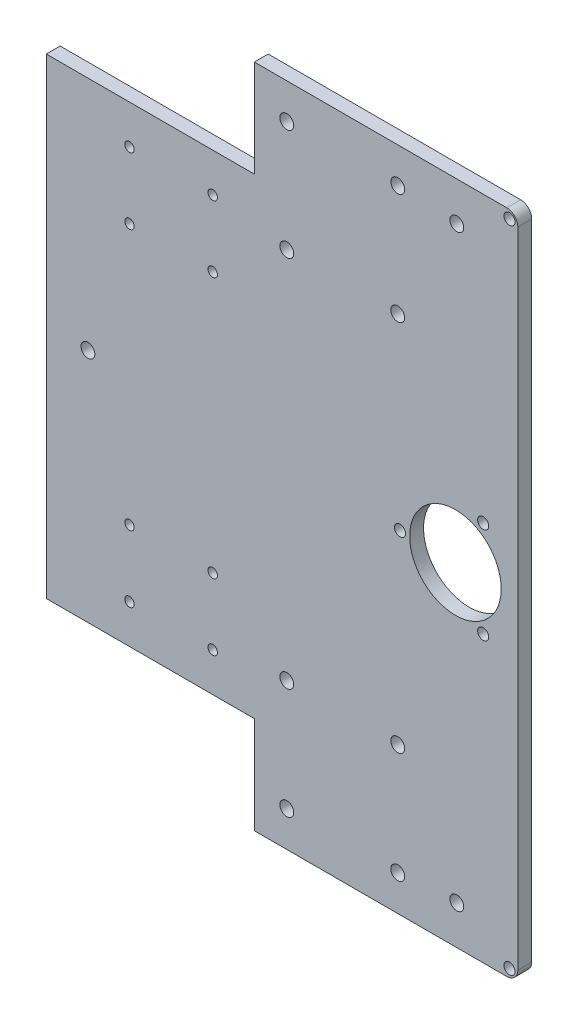
from build123d import *

# Parameters (mm, degrees)
SKETCH1_W           = 170
SKETCH1_H           = 240
BOSS_EXTRUDE1_DEPTH = 5
SKETCH2_R           = 16.5
CUT_EXTRUDE1_DEPTH  = 148.139389696
SKETCH3_R           = 2
CUT_EXTRUDE2_DEPTH  = 148.139389696
SKETCH4_R           = 1.7
CUT_EXTRUDE3_DEPTH  = 148.139389696
SKETCH5_W           = 75
SKETCH5_H           = 35
CUT_EXTRUDE4_DEPTH  = 148.139389696
FILLET1_R           = 4
SKETCH6_R           = 2
CUT_EXTRUDE5_DEPTH  = 148.139389696
FILLET2_R           = 4
SKETCH7_R           = 2.5
CUT_EXTRUDE6_DEPTH  = 148.139389696
SKETCH8_R           = 2.5
CUT_EXTRUDE7_DEPTH  = 148.139389696


with BuildPart() as part:
    # Sketch1 → Boss-Extrude1 (new body)
    with BuildSketch(Plane.XY):
        Rectangle(SKETCH1_W, SKETCH1_H)
    extrude(amount=BOSS_EXTRUDE1_DEPTH)

    # Sketch2 → Cut-Extrude1 (cut, through all)
    with BuildSketch(Plane.XY.offset(5)):
        with Locations((62.5, 0)):
            Circle(SKETCH2_R)
    extrude(amount=-CUT_EXTRUDE1_DEPTH, mode=Mode.SUBTRACT)

    # Sketch3 → Cut-Extrude2 (cut, through all)
    with BuildSketch(Plane.XY.offset(5)):
        with Locations((72.5, -17.320508076)):
            Circle(SKETCH3_R)
        with Locations((72.5, 17.320508076)):
            Circle(SKETCH3_R)
        with Locations((42.5, 0)):
            Circle(SKETCH3_R)
    extrude(amount=-CUT_EXTRUDE2_DEPTH, mode=Mode.SUBTRACT)

    # Sketch4 → Cut-Extrude3 (cut, through all)
    with BuildSketch(Plane.XY.offset(5)):
        with Locations((-25, 47)):
            Circle(SKETCH4_R)
        with Locations((-25, 71)):
            Circle(SKETCH4_R)
        with Locations((-55, 47)):
            Circle(SKETCH4_R)
        with Locations((-55, 71)):
            Circle(SKETCH4_R)
        with Locations((-55, -71)):
            Circle(SKETCH4_R)
        with Locations((-25, -71)):
            Circle(SKETCH4_R)
        with Locations((-55, -47)):
            Circle(SKETCH4_R)
        with Locations((-25, -47)):
            Circle(SKETCH4_R)
    extrude(amount=-CUT_EXTRUDE3_DEPTH, mode=Mode.SUBTRACT)

    # Sketch5 → Cut-Extrude4 (cut, through all)
    with BuildSketch(Plane.XY.offset(5)):
        with Locations((-47.5, 102.5)):
            Rectangle(SKETCH5_W, SKETCH5_H)
        with Locations((-47.5, -102.5)):
            Rectangle(SKETCH5_W, SKETCH5_H)
    extrude(amount=-CUT_EXTRUDE4_DEPTH, mode=Mode.SUBTRACT)

    # Fillet1
    fillet1_edges = [part.edges().sort_by_distance(p)[0] for p in [
        (85, -120, 2.5),
    ]]
    fillet(fillet1_edges, radius=FILLET1_R)

    # Sketch6 → Cut-Extrude5 (cut, through all)
    with BuildSketch(Plane.XY.offset(5)):
        with Locations((82, -117)):
            Circle(SKETCH6_R)
    cut_extrude5 = extrude(amount=-CUT_EXTRUDE5_DEPTH, mode=Mode.SUBTRACT)

    # Mirror5: Cut-Extrude5 across plane
    add(cut_extrude5.mirror(Plane.ZX), mode=Mode.SUBTRACT)

    # Fillet2
    fillet2_edges = [part.edges().sort_by_distance(p)[0] for p in [
        (85, 120, 2.5),
    ]]
    fillet(fillet2_edges, radius=FILLET2_R)

    # Sketch7 → Cut-Extrude6 (cut, through all)
    with BuildSketch(Plane.XY.offset(5)):
        with Locations((41.7, 107.25)):
            Circle(SKETCH7_R)
        with Locations((41.7, 67.25)):
            Circle(SKETCH7_R)
        with Locations((1.7, 67.25)):
            Circle(SKETCH7_R)
        with Locations((1.7, 107.25)):
            Circle(SKETCH7_R)
        with Locations((41.7, -107.25)):
            Circle(SKETCH7_R)
        with Locations((1.7, -107.25)):
            Circle(SKETCH7_R)
        with Locations((1.7, -67.25)):
            Circle(SKETCH7_R)
        with Locations((41.7, -67.25)):
            Circle(SKETCH7_R)
    extrude(amount=-CUT_EXTRUDE6_DEPTH, mode=Mode.SUBTRACT)

    # Sketch8 → Cut-Extrude7 (cut, through all)
    with BuildSketch(Plane(origin=(0, 0, 0), x_dir=(-1, 0, 0), z_dir=(0, 0, -1))):
        with Locations((-63, 106)):
            Circle(SKETCH8_R)
        with Locations((-63, -106)):
            Circle(SKETCH8_R)
        with Locations((70, 0)):
            Circle(SKETCH8_R)
    extrude(amount=-CUT_EXTRUDE7_DEPTH, mode=Mode.SUBTRACT)


solid = part.part
